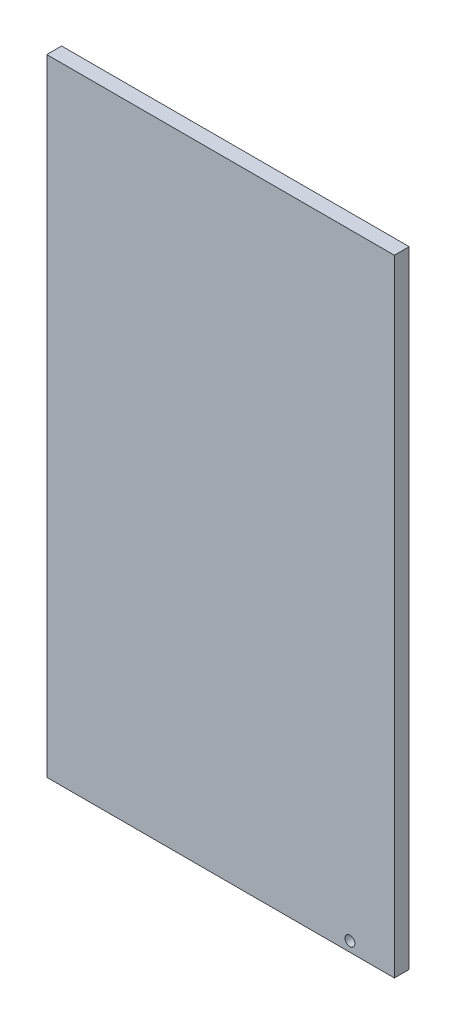
from build123d import *

# Parameters (mm, degrees)
SKETCH1_W           = 211
SKETCH1_H           = 380
BOSS_EXTRUDE1_DEPTH = 9
SKETCH2_R           = 3
CUT_EXTRUDE1_DEPTH  = 218.511493949


with BuildPart() as part:
    # Sketch1 → Boss-Extrude1 (new body)
    with BuildSketch(Plane.XY):
        Rectangle(SKETCH1_W, SKETCH1_H)
    extrude(amount=BOSS_EXTRUDE1_DEPTH)

    # Sketch2 → Cut-Extrude1 (cut, through all)
    with BuildSketch(Plane.XY.offset(9)):
        with Locations((78.5, -184)):
            Circle(SKETCH2_R)
    extrude(amount=-CUT_EXTRUDE1_DEPTH, mode=Mode.SUBTRACT)


solid = part.part
